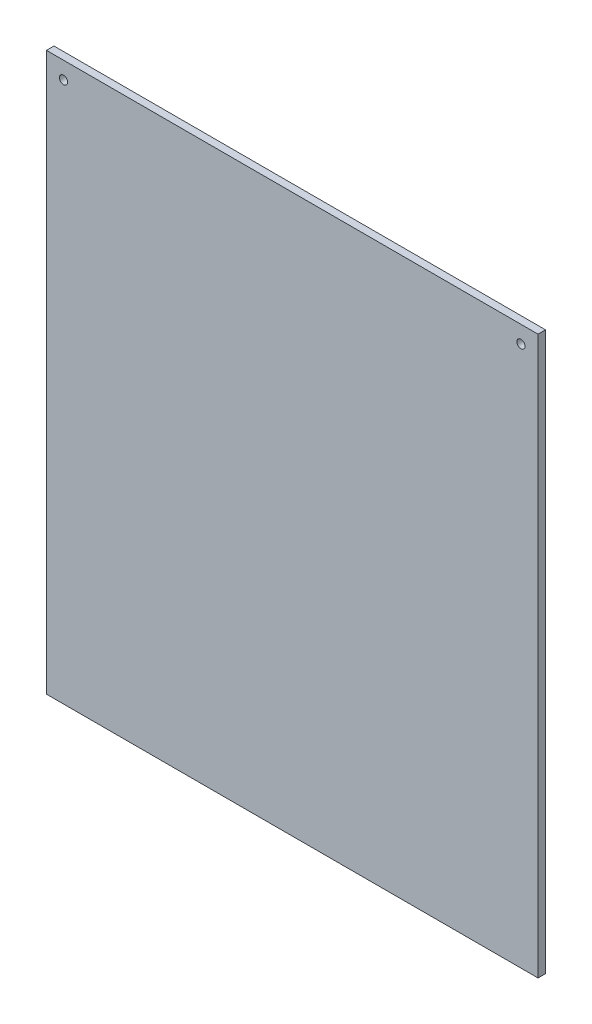
from build123d import *

# Parameters (mm, degrees)
SKETCH1_W           = 216
SKETCH1_H           = 245
SKETCH1_R           = 1.8
BOSS_EXTRUDE1_DEPTH = 3.302


with BuildPart() as part:
    # Sketch1 → Boss-Extrude1 (new body)
    with BuildSketch(Plane.XY):
        with Locations((-26.115183246, 2.382198953)):
            Rectangle(SKETCH1_W, SKETCH1_H)
        with Locations((-126.615183246, 117.382198953)):
            Circle(SKETCH1_R, mode=Mode.SUBTRACT)
        with Locations((74.384816754, 117.382198953)):
            Circle(SKETCH1_R, mode=Mode.SUBTRACT)
    extrude(amount=BOSS_EXTRUDE1_DEPTH)


solid = part.part
